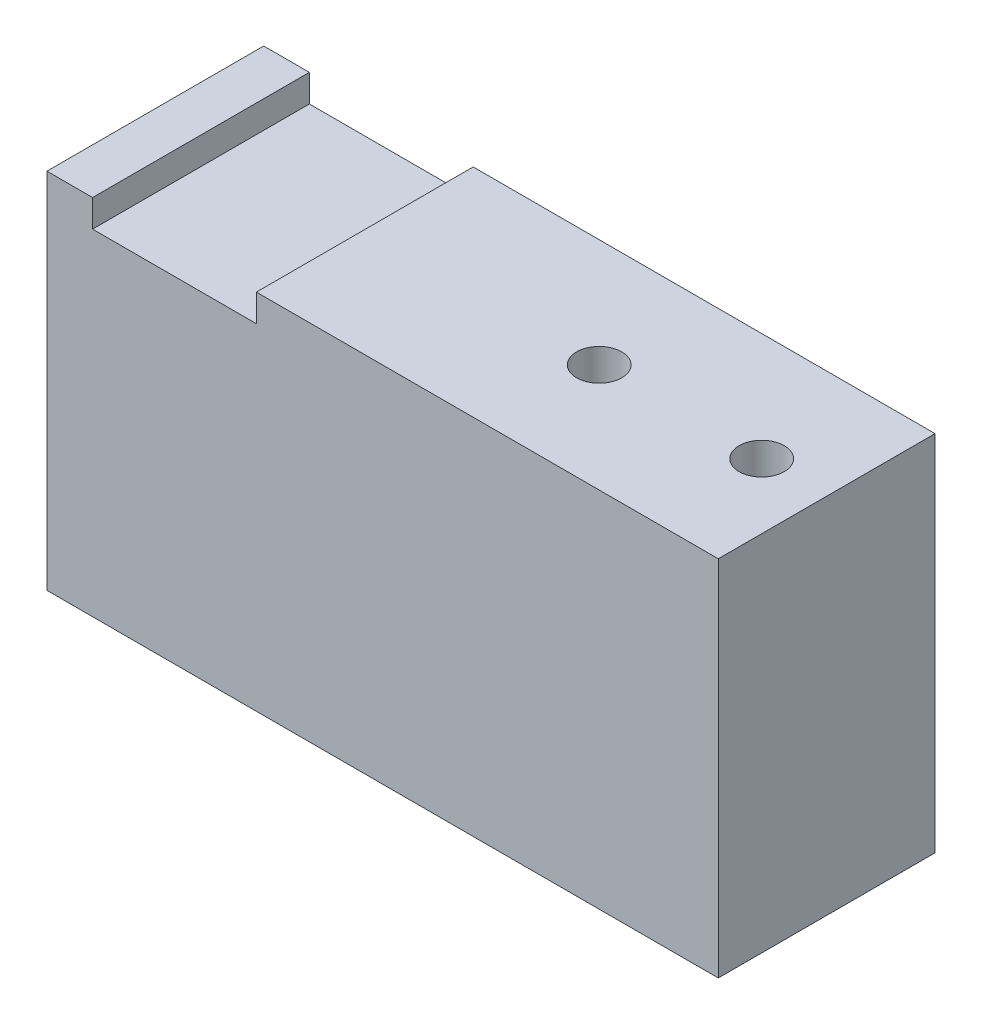
from build123d import *

# Parameters (mm, degrees)
SKETCH_216_W        = 62.5
SKETCH_216_H        = 20.18
EXTRUDE_1_DEPTH     = 33.8
SKETCH_6_W          = 15.25
SKETCH_6_H          = 20.18
CUT_EXTRUDE_1_DEPTH = 2.55
SKETCH_7_R          = 2.5
CUT_EXTRUDE_2_DEPTH = 15
SKETCH_8_R          = 2.1
CUT_EXTRUDE_3_DEPTH = 15


with BuildPart() as part:
    # Sketch 216 → Бобышка-Вытянуть1 (new body)
    with BuildSketch(Plane(origin=(0, 0, 0), x_dir=(1, 0, 0), z_dir=(0, 1, 0))):
        Rectangle(SKETCH_216_W, SKETCH_216_H)
    extrude(amount=EXTRUDE_1_DEPTH)

    # Эскиз6 → Вырез-Вытянуть1 (cut)
    with BuildSketch(Plane(origin=(0, 33.8, 0), x_dir=(1, 0, 0), z_dir=(0, 1, 0))):
        with Locations((-19.375, 0)):
            Rectangle(SKETCH_6_W, SKETCH_6_H)
    extrude(amount=-CUT_EXTRUDE_1_DEPTH, mode=Mode.SUBTRACT)

    # Эскиз7 → Вырез-Вытянуть2 (cut)
    with BuildSketch(Plane.XZ):
        with Locations((17, 0)):
            Circle(SKETCH_7_R)
        with Locations((-17, 0)):
            Circle(SKETCH_7_R)
    extrude(amount=-CUT_EXTRUDE_2_DEPTH, mode=Mode.SUBTRACT)

    # Эскиз8 → Вырез-Вытянуть3 (cut)
    with BuildSketch(Plane(origin=(0, 33.8, 0), x_dir=(1, 0, 0), z_dir=(0, 1, 0))):
        with Locations((25.2, 0)):
            Circle(SKETCH_8_R)
        with Locations((10.07, 0)):
            Circle(SKETCH_8_R)
    extrude(amount=-CUT_EXTRUDE_3_DEPTH, mode=Mode.SUBTRACT)


solid = part.part
